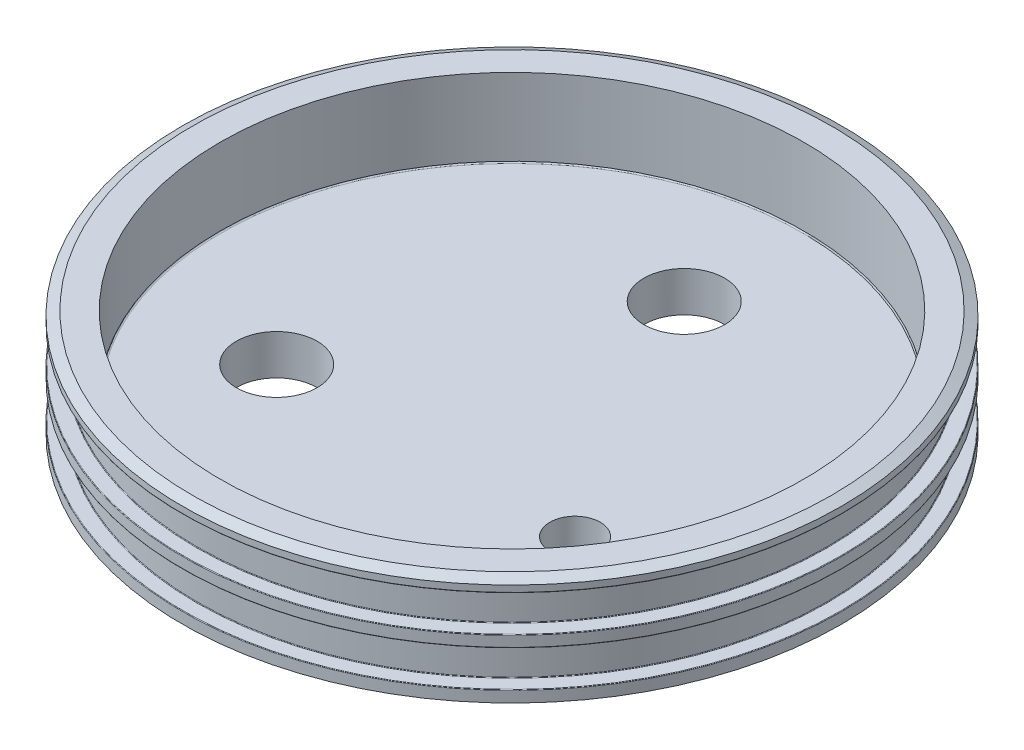
from build123d import *

# Parameters (mm, degrees)
SKETCH6_R                                = 66.04
BOSS_EXTRUDE1_DEPTH                      = 2.54
CNC_ID_FILLET_R                          = 0.127
CNC_OD_FILLET_R                          = 0.127
CNC_CHAMFERS_SIZE                        = 1.016
CNC_CHAMFERS_SIZE2                       = 2.178819031
CNC_BORE_FILLET_R                        = 0.254
PIPE_TAP_DRILL_FOR_1_2_TAP_FILL_VALVE_D  = 17.8562
PIPE_TAP_DRILL_FOR_1_4_TAP_SOLENOID_VA_D = 11.1252
PIPE_TAP_DRILL_FOR_1_2_TAP_CRYO_VALVE_D  = 17.8562


with BuildPart() as part:
    # Sketch1 → Revolve1 (revolve)
    with BuildSketch(Plane.XY):
        Polygon((0, 0), (72.898, 0), (72.898, 2.54), (69.6468, 2.54), (69.6468, 10.541), (72.898, 10.541), (72.898, 13.081), (69.6468, 13.081), (69.6468, 21.082), (72.898, 21.082), (72.898, 23.622), (64.5668, 23.622), (64.5668, 6.35), (0, 6.35), align=None)
    revolve(axis=Axis((0, 48.192213231, 0), (0, -1, 0)))

    # Sketch6 → Boss-Extrude1 (add)
    with BuildSketch(Plane.XZ):
        Circle(SKETCH6_R)
    extrude(amount=BOSS_EXTRUDE1_DEPTH)

    # CNC ID Fillet
    cnc_id_fillet_edges = [part.edges().sort_by_distance(p)[0] for p in [
        (-69.6468, 10.541, 0),
        (-69.6468, 2.54, 0),
        (-66.04, 0, 0),
        (-69.6468, 21.082, 0),
        (-69.6468, 13.081, 0),
    ]]
    fillet(cnc_id_fillet_edges, radius=CNC_ID_FILLET_R)

    # CNC OD Fillet
    cnc_od_fillet_edges = [part.edges().sort_by_distance(p)[0] for p in [
        (-72.898, 10.541, 0),
        (-72.898, 2.54, 0),
        (-72.898, 13.081, 0),
        (-72.898, 21.082, 0),
        (-66.04, -2.54, 0),
    ]]
    fillet(cnc_od_fillet_edges, radius=CNC_OD_FILLET_R)

    # CNC Chamfers
    cnc_chamfers_edges = [part.edges().sort_by_distance(p)[0] for p in [
        (-72.898, 23.622, 0),
    ]]
    cnc_chamfers_side = [part.faces().sort_by_distance(p)[0] for p in [
        (-72.898, 22.4155, 0),
    ]]
    chamfer(cnc_chamfers_edges, length=CNC_CHAMFERS_SIZE, length2=CNC_CHAMFERS_SIZE2, reference=cnc_chamfers_side[0])

    # CNC Bore Fillet
    cnc_bore_fillet_edges = [part.edges().sort_by_distance(p)[0] for p in [
        (-64.5668, 6.35, 0),
    ]]
    fillet(cnc_bore_fillet_edges, radius=CNC_BORE_FILLET_R)

    # Pipe Tap Drill for 1/2 Tap - Fill Valve (through all)
    with Locations(Plane(origin=(0, -2.54, 0), x_dir=(-1, 0, 0), z_dir=(0, -1, 0))):
        with Locations((0, 38.1)):
            Hole(PIPE_TAP_DRILL_FOR_1_2_TAP_FILL_VALVE_D / 2)

    # Pipe Tap Drill for 1/4 Tap - Solenoid Valve (through all)
    with Locations(Plane(origin=(0, -2.54, 0), x_dir=(-1, 0, 0), z_dir=(0, -1, 0))):
        with Locations((-32.995567884, -19.05)):
            Hole(PIPE_TAP_DRILL_FOR_1_4_TAP_SOLENOID_VA_D / 2)

    # Pipe Tap Drill for 1/2 Tap - Cryo Valve (through all)
    with Locations(Plane(origin=(0, -2.54, 0), x_dir=(-1, 0, 0), z_dir=(0, -1, 0))):
        with Locations((32.995567884, -19.05)):
            Hole(PIPE_TAP_DRILL_FOR_1_2_TAP_CRYO_VALVE_D / 2)


solid = part.part
